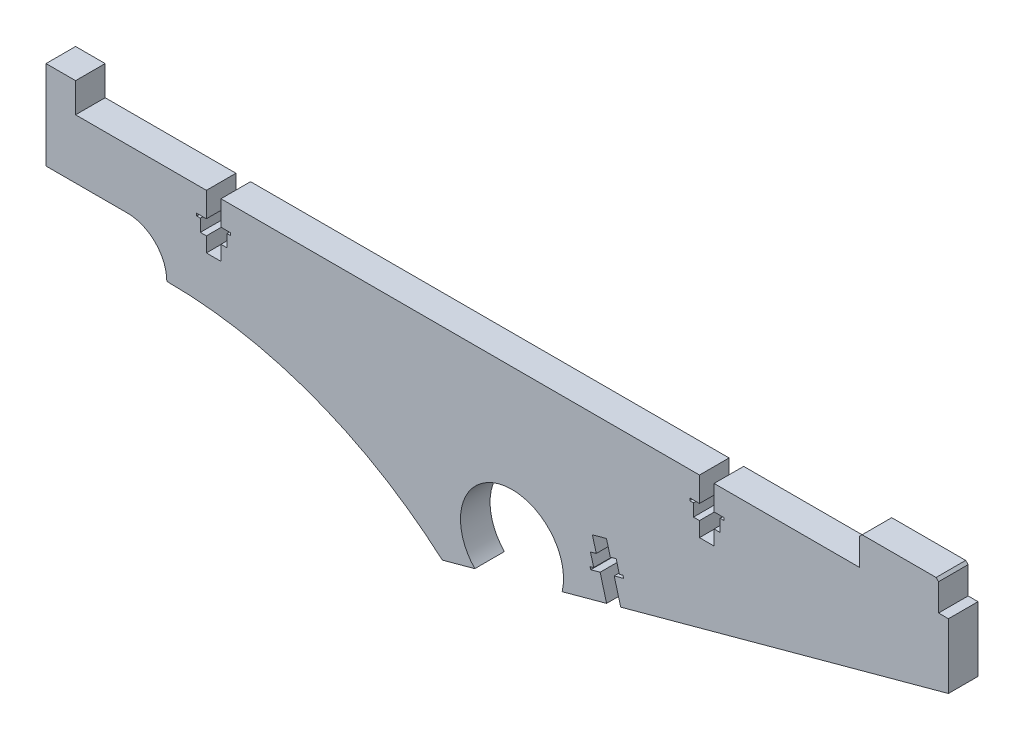
from build123d import *

# Parameters (mm, degrees)
BOSS_EXTRUDE1_DEPTH = 6
CHAMFER2_SIZE       = 0.5
CUT_EXTRUDE1_DEPTH  = 169.624583024


with BuildPart() as part:
    # Sketch1 → Boss-Extrude1 (new body)
    with BuildSketch(Plane.XY):
        with BuildLine():
            Line((116.02, 20), (116.02, 15))
            Line((116.02, 15), (114.05, 15))
            Line((114.05, 15), (114.05, 14.5))
            Line((114.05, 14.5), (114.8, 14.5))
            Line((114.8, 14.5), (114.8, 12))
            Line((114.8, 12), (116.02, 12))
            Line((116.02, 12), (116.02, 9))
            Line((116.02, 9), (118.98, 9))
            Line((118.98, 9), (118.98, 12))
            Line((118.98, 12), (120.2, 12))
            Line((120.2, 12), (120.2, 14.5))
            Line((120.2, 14.5), (120.95, 14.5))
            Line((120.95, 14.5), (120.95, 15))
            Line((120.95, 15), (118.98, 15))
            Line((118.98, 15), (118.98, 20))
            Line((118.98, 20), (148.5, 20))
            Line((148.5, 20), (148.5, 26))
            Line((148.5, 26), (164.5, 26))
            Line((164.5, 26), (164.5, 20))
            Line((164.5, 20), (166.5, 20))
            Line((166.5, 20), (166.5, 6.863840125))
            Line((166.5, 6.863840125), (88.166127224, -14.419164582))
            ThreePointArc((88.166127224, -14.419164582), (75.2601036, -1.915582926), (70.455783207, -19.230995297))
            Line((70.455783207, -19.230995297), (63.870699409, -21.020136629))
            ThreePointArc((63.870699409, -21.020136629), (37.847031663, -5.428892585), (8, 0))
            ThreePointArc((8, 0), (5.656854017, 5.656854482), (-6.59e-07, 8))
            Line((-6.59e-07, 8), (-16.5, 8))
            Line((-16.5, 8), (-16.5, 26))
            Line((-16.5, 26), (-10.5, 26))
            Line((-10.5, 26), (-10.5, 20))
            Line((-10.5, 20), (16.02, 20))
            Line((16.02, 20), (16.02, 15))
            Line((16.02, 15), (14.05, 15))
            Line((14.05, 15), (14.05, 14.5))
            Line((14.05, 14.5), (14.8, 14.5))
            Line((14.8, 14.5), (14.8, 12))
            Line((14.8, 12), (16.02, 12))
            Line((16.02, 12), (16.02, 9))
            Line((16.02, 9), (18.98, 9))
            Line((18.98, 9), (18.98, 12))
            Line((18.98, 12), (20.2, 12))
            Line((20.2, 12), (20.2, 14.5))
            Line((20.2, 14.5), (20.95, 14.5))
            Line((20.95, 14.5), (20.95, 15))
            Line((20.95, 15), (18.98, 15))
            Line((18.98, 15), (18.98, 20))
            Line((18.98, 20), (116.02, 20))
        make_face()
    extrude(amount=BOSS_EXTRUDE1_DEPTH)

    # Chamfer2
    chamfer2_edges = [part.edges().sort_by_distance(p)[0] for p in [
        (164.5, 26, 3),
        (148.5, 26, 3),
    ]]
    chamfer(chamfer2_edges, length=CHAMFER2_SIZE)

    # Sketch2 → Cut-Extrude1 (cut, through all)
    with BuildSketch(Plane.XY.offset(6)):
        Polygon((100.039498636, -11.193216334), (97.183051312, -11.969301821), (95.872096096, -7.144221882), (93.9710146, -7.660738237), (93.839919078, -7.178230243), (94.563681069, -6.981586961), (93.908203462, -4.569046991), (95.085522967, -4.249173918), (94.298949838, -1.354125954), (97.155397162, -0.578040467), (97.941970291, -3.473088431), (99.119289796, -3.153215358), (99.774767404, -5.565755328), (100.498529395, -5.369112046), (100.629624916, -5.851620039), (98.72854342, -6.368136394), align=None)
    extrude(amount=-CUT_EXTRUDE1_DEPTH, mode=Mode.SUBTRACT)


solid = part.part
